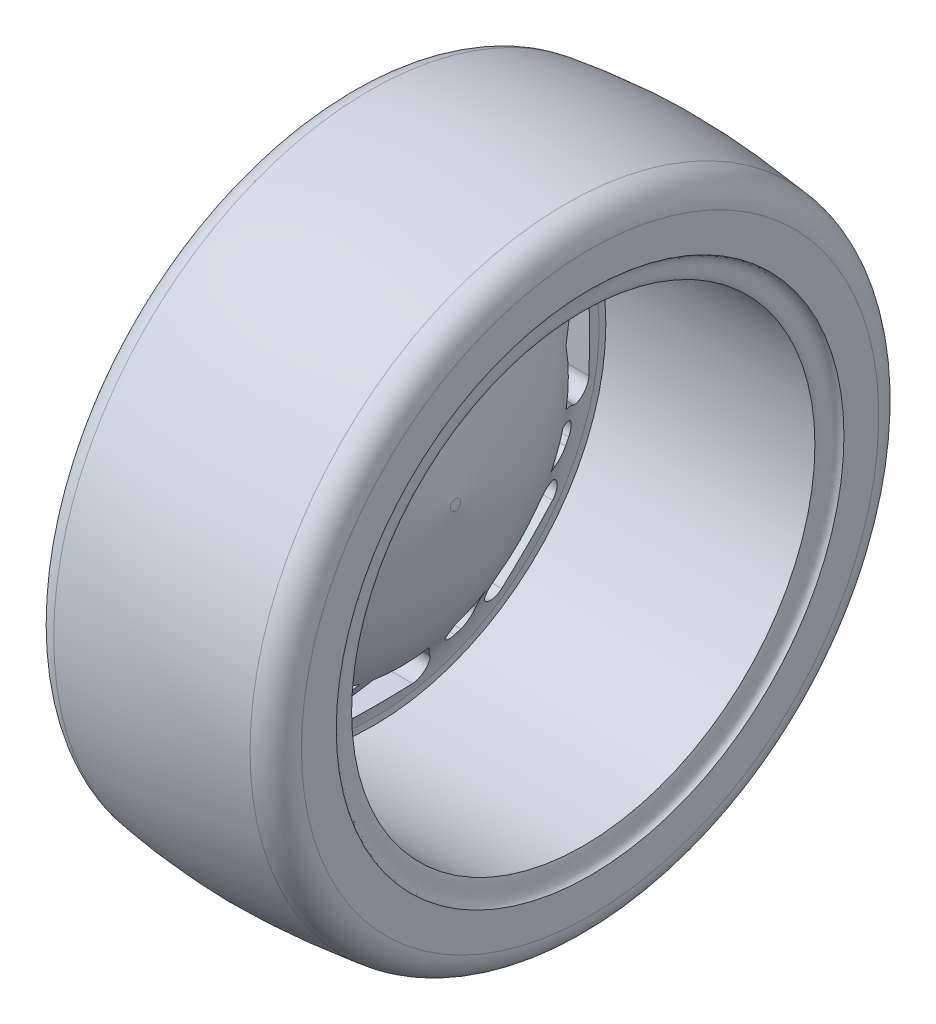
from build123d import *

# Parameters (mm, degrees)
CUT_EXTRUDE1_DEPTH = 20
CUT_EXTRUDE2_DEPTH = 20


with BuildPart() as part:
    # Sketch1 → Revolve6 (revolve)
    with BuildSketch(Plane.XY):
        with BuildLine():
            Line((-44.392159869, 6.203046167), (-44.392159869, -11.115906995))
            Line((-44.392159869, -11.115906995), (-44.126486924, -18.228453587))
            add(Edge.make_bspline(
                [(-44.126486924, -18.228453587), (-43.527766503, -23.918485856), (-35.324741542, -46.438740467), (-24.771793847, -45.208381497), (-14.286349511, -99.31148473)],
                knots=[0.038572731, 0.038572731, 0.038572731, 0.038572731, 0.225611803, 1, 1, 1, 1], degree=3))
            Line((-14.286349511, -99.31148473), (-4.46902104, -99.31148473))
            Line((-4.46902104, -99.31148473), (-4.46902104, -97.408838762))
            add(Edge.make_bspline(
                [(-34.181390489, -17.182003929), (-34.145144195, -17.526476191), (-34.060402354, -18.224743439), (-33.859028159, -19.531996), (-33.547293052, -21.066001798), (-33.095374824, -22.752606499), (-32.648602678, -24.103148795), (-32.256472773, -25.137590929), (-31.866295249, -26.086978392), (-31.166534189, -27.638949283), (-30.10432898, -29.661884285), (-28.737504086, -31.874425987), (-26.633578711, -34.953377703), (-23.966478501, -38.67976507), (-20.982319883, -43.600514681), (-18.685691271, -47.97242307), (-16.371034524, -53.14585801), (-14.048835137, -59.27061384), (-12.10039884, -65.317226908), (-10.527340232, -70.818558919), (-9.338825805, -75.302188066), (-8.140212777, -80.168863136), (-7.131734563, -84.565969971), (-6.318953548, -88.29976704), (-5.70537231, -91.215904527), (-5.09122557, -94.232756126), (-4.6724623, -96.359116581), (-4.46902104, -97.408838762)],
                knots=[0.038572731, 0.038572731, 0.038572731, 0.038572731, 0.053595032, 0.068617333, 0.098661936, 0.128706538, 0.15875114, 0.176799235, 0.191821536, 0.218840344, 0.278929548, 0.339018753, 0.399107957, 0.519286366, 0.57937557, 0.639464774, 0.699553979, 0.759643183, 0.819732387, 0.849776989, 0.879821591, 0.909866194, 0.939910796, 0.954933097, 0.969955398, 0.984977699, 1, 1, 1, 1], degree=3))
            Line((-34.181390489, -17.182003929), (-34.181390489, -14.672180291))
            Line((-34.181390489, -14.672180291), (42.189870221, -14.672180291))
            add(Edge.make_bspline(
                [(44.697036026, -6.567825526), (41.402075614, -8.083314212), (43.245973894, -12.275178782), (42.189870221, -14.672180291)],
                knots=[0, 0, 0, 0, 1, 1, 1, 1], degree=3))
            Line((44.697036026, -6.567825526), (44.697036026, 6.15918397))
            ThreePointArc((44.697036026, 6.15918397), (42.168855742, 12.805379132), (35.862654001, 16.091018379))
            add(Edge.make_bspline(
                [(-35.864706466, 16.094032291), (-23.937325611, 17.869752516), (0.035883992, 19.829058674), (23.863133821, 17.49930368), (35.862654001, 16.091018379)],
                knots=[0.096298262, 0.096298262, 0.096298262, 0.096298262, 0.50012439, 0.903930042, 0.903930042, 0.903930042, 0.903930042], degree=3))
            ThreePointArc((-35.864706466, 16.094032291), (-41.965978786, 12.732767984), (-44.392159869, 6.203046167))
        make_face()
    revolve(axis=Axis((-14.286349511, -99.31148473, 0), (1, 0, 0)))

    # Sketch2 → Cut-Extrude1 (cut)
    with BuildSketch(Plane.ZY.offset(44.392159869)):
        with BuildLine():
            Line((46.072042754, -35.164796474), (64.689033154, -53.781786874))
            ThreePointArc((64.689033154, -53.781786874), (65.892172661, -58.912618333), (61.831029625, -62.271203357))
            Line((61.831029625, -62.271203357), (46.159790291, -64.414520349))
            ThreePointArc((46.159790291, -64.414520349), (37.59357781, -61.434907241), (34.959121044, -52.756328551))
            Line((34.959121044, -52.756328551), (37.613704602, -37.825117058))
            ThreePointArc((37.613704602, -37.825117058), (41.036356805, -33.930682191), (46.072042754, -35.164796474))
        make_face()
        with BuildLine():
            Line((-16.880521942, -29.237151609), (-8.199635079, -41.672186542))
            ThreePointArc((-8.199635079, -41.672186542), (-0.200110992, -45.946026141), (7.964020576, -41.995703841))
            Line((7.964020576, -41.995703841), (17.5297062, -29.398910259))
            ThreePointArc((17.5297062, -29.398910259), (18.026489734, -24.152370232), (13.547695912, -21.37507262))
            Line((13.547695912, -21.37507262), (-12.780704402, -21.37507262))
            ThreePointArc((-12.780704402, -21.37507262), (-17.214122663, -24.063189723), (-16.880521942, -29.237151609))
        make_face()
        with BuildLine():
            Line((77.936412111, -86.530780328), (77.936412111, -112.859180642))
            ThreePointArc((77.936412111, -112.859180642), (75.159114498, -117.337974464), (69.912574472, -116.84119093))
            Line((69.912574472, -116.84119093), (57.31578089, -107.275505306))
            ThreePointArc((57.31578089, -107.275505306), (53.365458589, -99.111373738), (57.639298188, -91.111849651))
            Line((57.639298188, -91.111849651), (70.074333121, -82.430962789))
            ThreePointArc((70.074333121, -82.430962789), (75.248295007, -82.097362067), (77.936412111, -86.530780328))
        make_face()
        with BuildLine():
            Line((64.146688256, -145.383527484), (45.529697856, -164.000517884))
            ThreePointArc((45.529697856, -164.000517884), (40.398866398, -165.203657391), (37.040281373, -161.142514355))
            Line((37.040281373, -161.142514355), (34.896964382, -145.471275021))
            ThreePointArc((34.896964382, -145.471275021), (37.876577489, -136.90506254), (46.555156179, -134.270605775))
            Line((46.555156179, -134.270605775), (61.486367672, -136.925189332))
            ThreePointArc((61.486367672, -136.925189332), (65.380802539, -140.347841535), (64.146688256, -145.383527484))
        make_face()
        with BuildLine():
            Line((12.780704402, -177.247896841), (-13.547695912, -177.247896841))
            ThreePointArc((-13.547695912, -177.247896841), (-18.026489734, -174.470599228), (-17.5297062, -169.224059202))
            Line((-17.5297062, -169.224059202), (-7.964020576, -156.62726562))
            ThreePointArc((-7.964020576, -156.62726562), (0.200110992, -152.676943319), (8.199635079, -156.950782919))
            Line((8.199635079, -156.950782919), (16.880521942, -169.385817851))
            ThreePointArc((16.880521942, -169.385817851), (17.214122663, -174.559779737), (12.780704402, -177.247896841))
        make_face()
        with BuildLine():
            Line((-46.072042754, -163.458172986), (-64.689033154, -144.841182586))
            ThreePointArc((-64.689033154, -144.841182586), (-65.892172661, -139.710351128), (-61.831029625, -136.351766103))
            Line((-61.831029625, -136.351766103), (-46.159790291, -134.208449112))
            ThreePointArc((-46.159790291, -134.208449112), (-37.59357781, -137.188062219), (-34.959121044, -145.86664091))
            Line((-34.959121044, -145.86664091), (-37.613704602, -160.797852402))
            ThreePointArc((-37.613704602, -160.797852402), (-41.036356805, -164.692287269), (-46.072042754, -163.458172986))
        make_face()
        with BuildLine():
            Line((-77.936412111, -112.092189132), (-77.936412111, -85.763788818))
            ThreePointArc((-77.936412111, -85.763788818), (-75.159114498, -81.284994996), (-69.912574471, -81.78177853))
            Line((-69.912574471, -81.78177853), (-57.31578089, -91.347464155))
            ThreePointArc((-57.31578089, -91.347464155), (-53.365458589, -99.511595722), (-57.639298188, -107.511119809))
            Line((-57.639298188, -107.511119809), (-70.074333121, -116.192006672))
            ThreePointArc((-70.074333121, -116.192006672), (-75.248295007, -116.525607393), (-77.936412111, -112.092189132))
        make_face()
        with BuildLine():
            Line((-64.146688256, -53.239441977), (-45.529697856, -34.622451576))
            ThreePointArc((-45.529697856, -34.622451576), (-40.398866398, -33.419312069), (-37.040281373, -37.480455105))
            Line((-37.040281373, -37.480455105), (-34.896964382, -53.15169444))
            ThreePointArc((-34.896964382, -53.15169444), (-37.876577489, -61.71790692), (-46.555156179, -64.352363686))
            Line((-46.555156179, -64.352363686), (-61.486367672, -61.697780128))
            ThreePointArc((-61.486367672, -61.697780128), (-65.380802539, -58.275127925), (-64.146688256, -53.239441977))
        make_face()
    extrude(amount=-CUT_EXTRUDE1_DEPTH, mode=Mode.SUBTRACT)

    # Sketch3 → Cut-Extrude2 (cut)
    with BuildSketch(Plane.ZY.offset(44.392159869)):
        with BuildLine():
            Line((-27.015610062, -30.137507995), (-29.172487539, -31.459465158))
            ThreePointArc((-29.172487539, -31.459465158), (-31.421613759, -34.555606658), (-30.822683511, -38.33528171))
            Line((-30.822683511, -38.33528171), (-18.966159133, -57.680137275))
            ThreePointArc((-18.966159133, -57.680137275), (-15.870017633, -59.929263495), (-12.090342581, -59.330333248))
            Line((-12.090342581, -59.330333248), (-9.933465104, -58.008376084))
            ThreePointArc((-9.933465104, -58.008376084), (-7.684338884, -54.912234584), (-8.283269132, -51.132559532))
            Line((-8.283269132, -51.132559532), (-20.13979351, -31.787703967))
            ThreePointArc((-20.13979351, -31.787703967), (-23.23593501, -29.538577747), (-27.015610062, -30.137507995))
        make_face()
        with BuildLine():
            Line((28.210488944, -59.386684239), (33.505538706, -37.323976899))
            ThreePointArc((33.505538706, -37.323976899), (32.906608458, -33.544301846), (29.810466959, -31.295175626))
            Line((29.810466959, -31.295175626), (27.350559394, -30.704797811))
            ThreePointArc((27.350559394, -30.704797811), (23.570884342, -31.303728058), (21.321758121, -34.399869558))
            Line((21.321758121, -34.399869558), (16.02670836, -56.462576899))
            ThreePointArc((16.02670836, -56.462576899), (16.625638607, -60.242251951), (19.721780107, -62.491378171))
            Line((19.721780107, -62.491378171), (22.181687672, -63.081755987))
            ThreePointArc((22.181687672, -63.081755987), (25.961362724, -62.482825739), (28.210488944, -59.386684239))
        make_face()
        with BuildLine():
            Line((48.178925198, -91.028215599), (67.523780763, -79.17169122))
            ThreePointArc((67.523780763, -79.17169122), (69.772906983, -76.07554972), (69.173976735, -72.295874668))
            Line((69.173976735, -72.295874668), (67.852019572, -70.138997191))
            ThreePointArc((67.852019572, -70.138997191), (64.755878072, -67.889870971), (60.97620302, -68.488801219))
            Line((60.97620302, -68.488801219), (41.631347455, -80.345325597))
            ThreePointArc((41.631347455, -80.345325597), (39.382221235, -83.441467097), (39.981151483, -87.221142149))
            Line((39.981151483, -87.221142149), (41.303108646, -89.378019626))
            ThreePointArc((41.303108646, -89.378019626), (44.399250146, -91.627145846), (48.178925198, -91.028215599))
        make_face()
        with BuildLine():
            Line((39.924800491, -127.521973674), (61.987507832, -132.817023436))
            ThreePointArc((61.987507832, -132.817023436), (65.767182884, -132.218093188), (68.016309104, -129.121951689))
            Line((68.016309104, -129.121951689), (68.60668692, -126.662044124))
            ThreePointArc((68.60668692, -126.662044124), (68.007756672, -122.882369072), (64.911615172, -120.633242852))
            Line((64.911615172, -120.633242852), (42.848907831, -115.33819309))
            ThreePointArc((42.848907831, -115.33819309), (39.069232779, -115.937123338), (36.820106559, -119.033264837))
            Line((36.820106559, -119.033264837), (36.229728743, -121.493172402))
            ThreePointArc((36.229728743, -121.493172402), (36.828658991, -125.272847454), (39.924800491, -127.521973674))
        make_face()
        with BuildLine():
            Line((8.283269132, -147.490409928), (20.13979351, -166.835265493))
            ThreePointArc((20.13979351, -166.835265493), (23.23593501, -169.084391713), (27.015610062, -168.485461466))
            Line((27.015610062, -168.485461466), (29.172487539, -167.163504302))
            ThreePointArc((29.172487539, -167.163504302), (31.421613759, -164.067362803), (30.822683511, -160.287687751))
            Line((30.822683511, -160.287687751), (18.966159133, -140.942832185))
            ThreePointArc((18.966159133, -140.942832185), (15.870017633, -138.693705965), (12.090342581, -139.292636213))
            Line((12.090342581, -139.292636213), (9.933465104, -140.614593376))
            ThreePointArc((9.933465104, -140.614593376), (7.684338884, -143.710734876), (8.283269132, -147.490409928))
        make_face()
        with BuildLine():
            Line((-28.210488944, -139.236285221), (-33.505538706, -161.298992562))
            ThreePointArc((-33.505538706, -161.298992562), (-32.906608458, -165.078667614), (-29.810466959, -167.327793834))
            Line((-29.810466959, -167.327793834), (-27.350559394, -167.91817165))
            ThreePointArc((-27.350559394, -167.91817165), (-23.570884342, -167.319241402), (-21.321758121, -164.223099902))
            Line((-21.321758121, -164.223099902), (-16.02670836, -142.160392562))
            ThreePointArc((-16.02670836, -142.160392562), (-16.625638607, -138.380717509), (-19.721780107, -136.131591289))
            Line((-19.721780107, -136.131591289), (-22.181687672, -135.541213474))
            ThreePointArc((-22.181687672, -135.541213474), (-25.961362724, -136.140143722), (-28.210488944, -139.236285221))
        make_face()
        with BuildLine():
            Line((-48.178925198, -107.594753862), (-67.523780763, -119.451278241))
            ThreePointArc((-67.523780763, -119.451278241), (-69.772906983, -122.54741974), (-69.173976735, -126.327094792))
            Line((-69.173976735, -126.327094792), (-67.852019572, -128.483972269))
            ThreePointArc((-67.852019572, -128.483972269), (-64.755878072, -130.73309849), (-60.97620302, -130.134168242))
            Line((-60.97620302, -130.134168242), (-41.631347455, -118.277643863))
            ThreePointArc((-41.631347455, -118.277643863), (-39.382221235, -115.181502363), (-39.981151483, -111.401827311))
            Line((-39.981151483, -111.401827311), (-41.303108646, -109.244949834))
            ThreePointArc((-41.303108646, -109.244949834), (-44.399250146, -106.995823614), (-48.178925198, -107.594753862))
        make_face()
        with BuildLine():
            Line((-39.924800491, -71.100995786), (-61.987507832, -65.805946024))
            ThreePointArc((-61.987507832, -65.805946024), (-65.767182884, -66.404876272), (-68.016309104, -69.501017772))
            Line((-68.016309104, -69.501017772), (-68.60668692, -71.960925337))
            ThreePointArc((-68.60668692, -71.960925337), (-68.007756672, -75.740600389), (-64.911615172, -77.989726609))
            Line((-64.911615172, -77.989726609), (-42.848907831, -83.284776371))
            ThreePointArc((-42.848907831, -83.284776371), (-39.069232779, -82.685846123), (-36.820106559, -79.589704623))
            Line((-36.820106559, -79.589704623), (-36.229728743, -77.129797058))
            ThreePointArc((-36.229728743, -77.129797058), (-36.828658991, -73.350122006), (-39.924800491, -71.100995786))
        make_face()
    extrude(amount=-CUT_EXTRUDE2_DEPTH, mode=Mode.SUBTRACT)


solid = part.part
